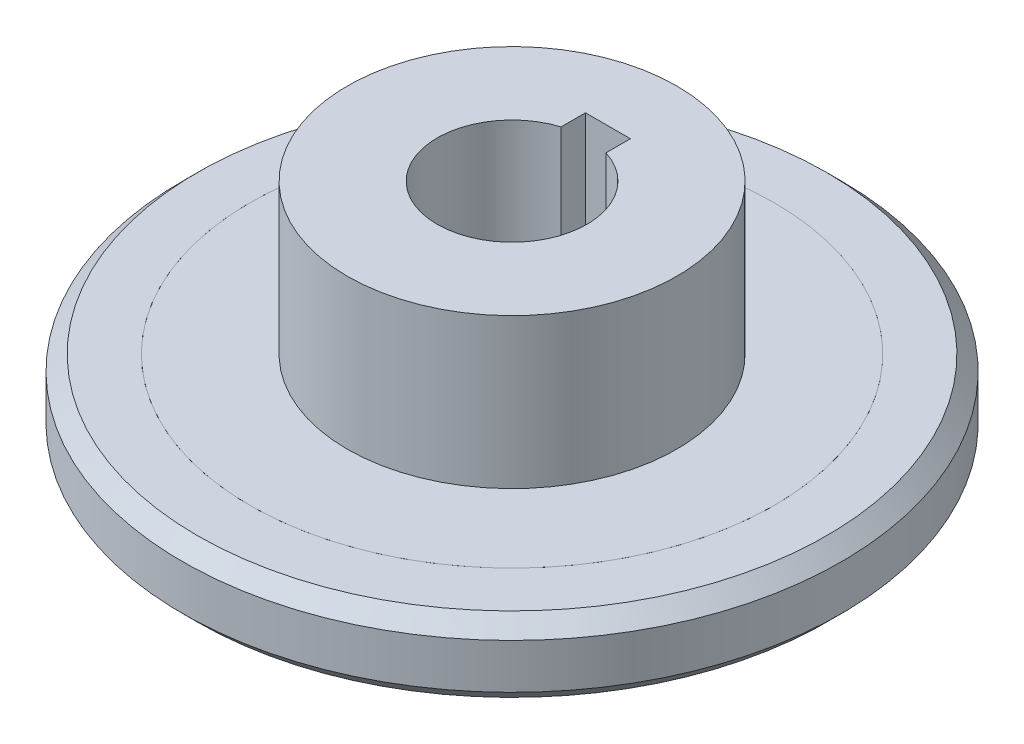
from build123d import *

# Parameters (mm, degrees)
SKETCH_2_W          = 3
SKETCH_2_H          = 54.842712326
CUT_EXTRUDE_1_DEPTH = 6.4


with BuildPart() as part:
    # Эскиз1 → Revolve 1 (revolve)
    with BuildSketch(Plane.XY):
        Polygon((5, 15), (5, 0), (17.5, 0), (17.5, 5), (11, 5), (11, 15), align=None)
    revolve(axis=Axis((0, 0, 0), (0, 1, 0)))

    # Эскиз2 → Вырез-Вытянуть1 (cut)
    with BuildSketch(Plane.XY):
        Rectangle(SKETCH_2_W, SKETCH_2_H)
    extrude(amount=-CUT_EXTRUDE_1_DEPTH, mode=Mode.SUBTRACT)

    # Эскиз3 → Revolve 1 2 (revolve)
    with BuildSketch(Plane.XY):
        Polygon((17.4999, -0.0001), (17.4999, 5.0001), (21.000041421, 5.0001), (22.0001, 4.000041421), (22.0001, 0.999958579), (21.000041421, -0.0001), align=None)
        Polygon((17.5, 0), (17.5, 5), (21, 5), (22, 4), (22, 1), (21, 0), align=None, mode=Mode.SUBTRACT)
    revolve(axis=Axis((0, 0, 0), (0, 1, 0)))


solid = part.part
